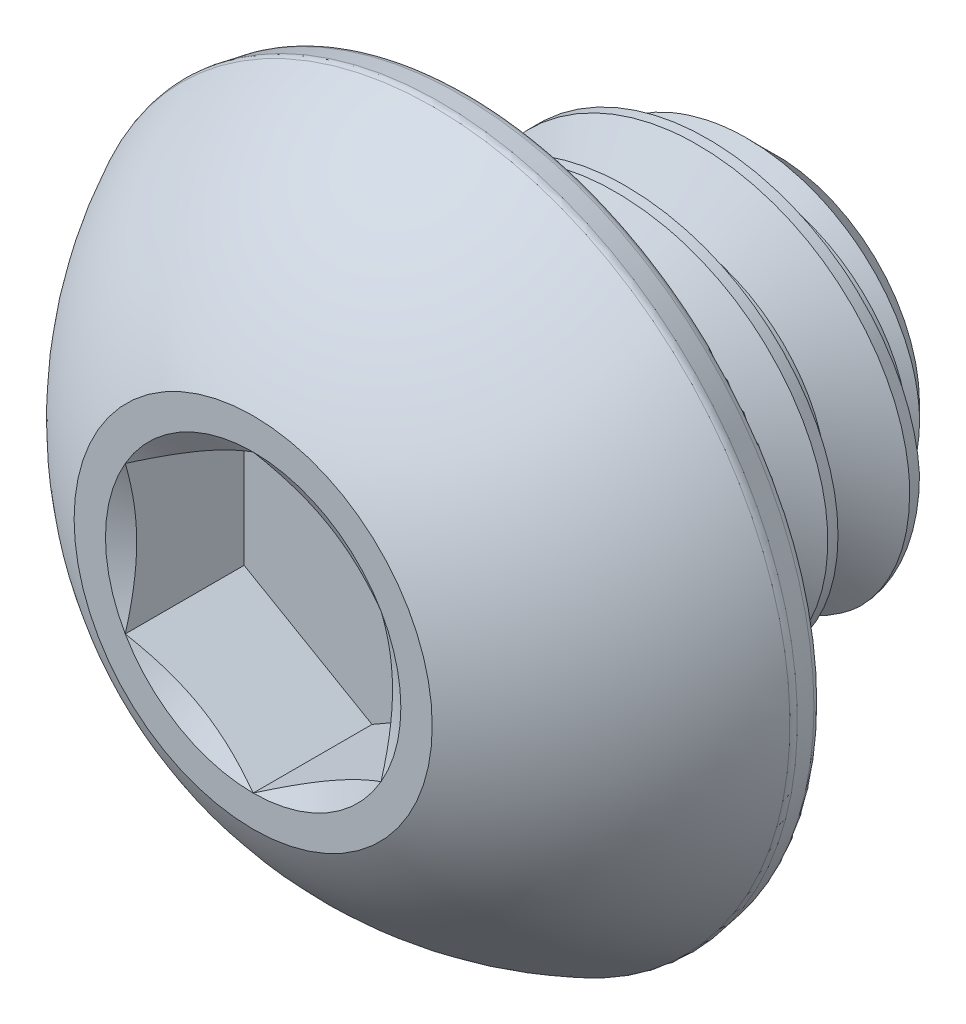
from build123d import *

# Parameters (mm, degrees)
CUT_EXTRUDE1_DEPTH  = 1.84404
FILLET1_R           = 0.16764
CUT_SWEEP1_PITCH    = 1.27
CUT_SWEEP1_TO       = 4.7625
SKETCH8_R           = 3.312481533
BOSS_EXTRUDE1_DEPTH = 2.8575
BOSS_EXTRUDE1_TAPER = 45


with BuildPart() as part:
    # Sketch3 → Revolve1 (revolve)
    with BuildSketch(Plane(origin=(0, 0, 0), x_dir=(0, 0, -1), z_dir=(1, 0, 0)), mode=Mode.PRIVATE) as revolve1_sk:
        with BuildLine():
            Line((-4.05765, 0), (-4.05765, 2.778125))
            ThreePointArc((-4.05765, 2.778125), (-2.863274687, 4.401074199), (-1.20777, 5.5499))
            Line((-1.20777, 5.5499), (-0.70485, 5.461221635))
            Line((-0.70485, 5.461221635), (-0.70485, 3.175))
            Line((-0.70485, 3.175), (3.10515, 3.175))
            Line((3.10515, 3.175), (4.05765, 2.2225))
            Line((4.05765, 2.2225), (4.05765, 0))
            Line((4.05765, 0), (-4.05765, 0))
        make_face()
    revolve(revolve1_sk.sketch.rotate(Axis((0, 0, 4.05765), (0, 0, -1)), 90), axis=Axis((0, 0, 4.05765), (0, 0, -1)))

    # Sketch4 → Cut-Extrude1 (cut)
    with BuildSketch(Plane.XY.offset(4.05765)):
        Polygon((-1.984375, -1.14567944), (0, -2.291358881), (1.984375, -1.14567944), (1.984375, 1.14567944), (0, 2.291358881), (-1.984375, 1.14567944), align=None)
    extrude(amount=-CUT_EXTRUDE1_DEPTH, mode=Mode.SUBTRACT)

    # Cut-Extrude2 cone 1 section (through the dimple's axis) → Cut-Extrude2 (revolve, cut)
    with BuildSketch(Plane(origin=(0, 0, 4.05765), x_dir=(0, -1, 0), z_dir=(1, 0, 0))):
        Polygon((0, 0), (2.291358881, 0), (0, 1.322916667), align=None)
    revolve(axis=Axis((0, 0, 4.05765), (0, 0, -1)), mode=Mode.SUBTRACT)

    # Fillet1
    fillet1_edges = [part.edges().sort_by_distance(p)[0] for p in [
        (-5.461221635, 0, 0.70485),
        (-5.5499, 0, 1.20777),
    ]]
    fillet(fillet1_edges, radius=FILLET1_R)


with BuildPart() as body_2:
    # Split1: read off the stored shape, not the designer's step
    # Split1: the piece on the far side of the plane
    add(part.part)
    split(bisect_by=Plane.XY.offset(0.70485), keep=Keep.BOTTOM)

    # Cut-Sweep1: arcs per turn and ends read off the stored shape
    # Cut-Sweep1: the profile of Sketch7 screwed along a right-hand helix through 4.75 turns, 8 arcs to a turn; built about Z, then put on its axis
    cut_sweep1_z = Axis((0, 0, 0), (0, 0, 1))
    cut_sweep1_corners = [(3.243740766, 0, 0.0396875), (3.243740766, 0, -1.1509375), (2.350110803, 0, -0.635), (2.350110803, 0, -0.47625)]
    with BuildLine(mode=Mode.PRIVATE) as cut_sweep1_profile:
        Line(cut_sweep1_corners[0], cut_sweep1_corners[1])
        Line(cut_sweep1_corners[1], cut_sweep1_corners[2])
        Line(cut_sweep1_corners[2], cut_sweep1_corners[3])
        Line(cut_sweep1_corners[3], cut_sweep1_corners[0])
    cut_sweep1_cap = Face(cut_sweep1_profile.wire())
    cut_sweep1_turn_angles = [0, 22.5, 45, 67.5, 90, 112.5, 135, 157.5, 180, 202.5, 225, 247.5, 270, 292.5, 315, 337.5, 360]
    cut_sweep1_turn_weights = [1, 0.9238795325112867, 1, 0.9238795325112867, 1, 0.9238795325112867, 1, 0.9238795325112867, 1, 0.9238795325112867, 1, 0.9238795325112867, 1, 0.9238795325112867, 1, 0.9238795325112867, 1]
    cut_sweep1_turn_rails = [Edge.make_bspline([Vector(p[0], p[1], 0).rotate(cut_sweep1_z, cut_sweep1_turn_angles[k]) / cut_sweep1_turn_weights[k] + Vector(0, 0, p[2] + CUT_SWEEP1_PITCH * cut_sweep1_turn_angles[k] / 360) for k in range(17)], [0, 0, 0, 1, 1, 2, 2, 3, 3, 4, 4, 5, 5, 6, 6, 7, 7, 8, 8, 8], 2, cut_sweep1_turn_weights) for p in cut_sweep1_corners]
    cut_sweep1_turn_sides = [Face.make_surface_from_curves(cut_sweep1_turn_rails[p[0]], cut_sweep1_turn_rails[p[1]]) for p in [(0, 1), (1, 2), (2, 3), (3, 0)]]
    cut_sweep1_last_angles = [1440, 1462.5, 1485, 1507.5, 1530, 1552.5, 1575, 1597.5, 1620, 1642.5, 1665, 1687.5, 1710]
    cut_sweep1_last_weights = [1, 0.9238795325112867, 1, 0.9238795325112867, 1, 0.9238795325112867, 1, 0.9238795325112867, 1, 0.9238795325112867, 1, 0.9238795325112746, 1]
    cut_sweep1_last_rails = [Edge.make_bspline([Vector(p[0], p[1], 0).rotate(cut_sweep1_z, cut_sweep1_last_angles[k]) / cut_sweep1_last_weights[k] + Vector(0, 0, p[2] + CUT_SWEEP1_PITCH * cut_sweep1_last_angles[k] / 360) for k in range(13)], [0, 0, 0, 1, 1, 2, 2, 3, 3, 4, 4, 5, 5, 6, 6, 6], 2, cut_sweep1_last_weights) for p in cut_sweep1_corners]
    cut_sweep1_last_sides = [Face.make_surface_from_curves(cut_sweep1_last_rails[p[0]], cut_sweep1_last_rails[p[1]]) for p in [(0, 1), (1, 2), (2, 3), (3, 0)]]
    cut_sweep1 = Plane(origin=(0, 0, -4.05765), x_dir=(0, 1, 0), z_dir=(0, 0, 1)) * split(Solid(Shell([*[p.moved(Location((0, 0, CUT_SWEEP1_PITCH * i))) for i in range(4) for p in cut_sweep1_turn_sides], *cut_sweep1_last_sides, cut_sweep1_cap, cut_sweep1_cap.rotate(cut_sweep1_z, 1710).moved(Location((0, 0, CUT_SWEEP1_PITCH * 1710 / 360)))])), bisect_by=Plane.XY.offset(CUT_SWEEP1_TO), keep=Keep.BOTTOM, mode=Mode.PRIVATE)
    add(cut_sweep1, mode=Mode.SUBTRACT)


with BuildPart() as part_1:
    add(part.part)

    # Split1
    split(bisect_by=Plane.XY.offset(0.70485), keep=Keep.TOP)

    add(body_2.part)  # Boss-Extrude1 merges body 2
    # Sketch8 → Boss-Extrude1 (add)
    with BuildSketch(Plane(origin=(0, 0, 0.70485), x_dir=(-1, 0, 0), z_dir=(0, 0, -1))):
        Circle(SKETCH8_R)
    extrude(amount=BOSS_EXTRUDE1_DEPTH, taper=BOSS_EXTRUDE1_TAPER)


solid = part_1.part
